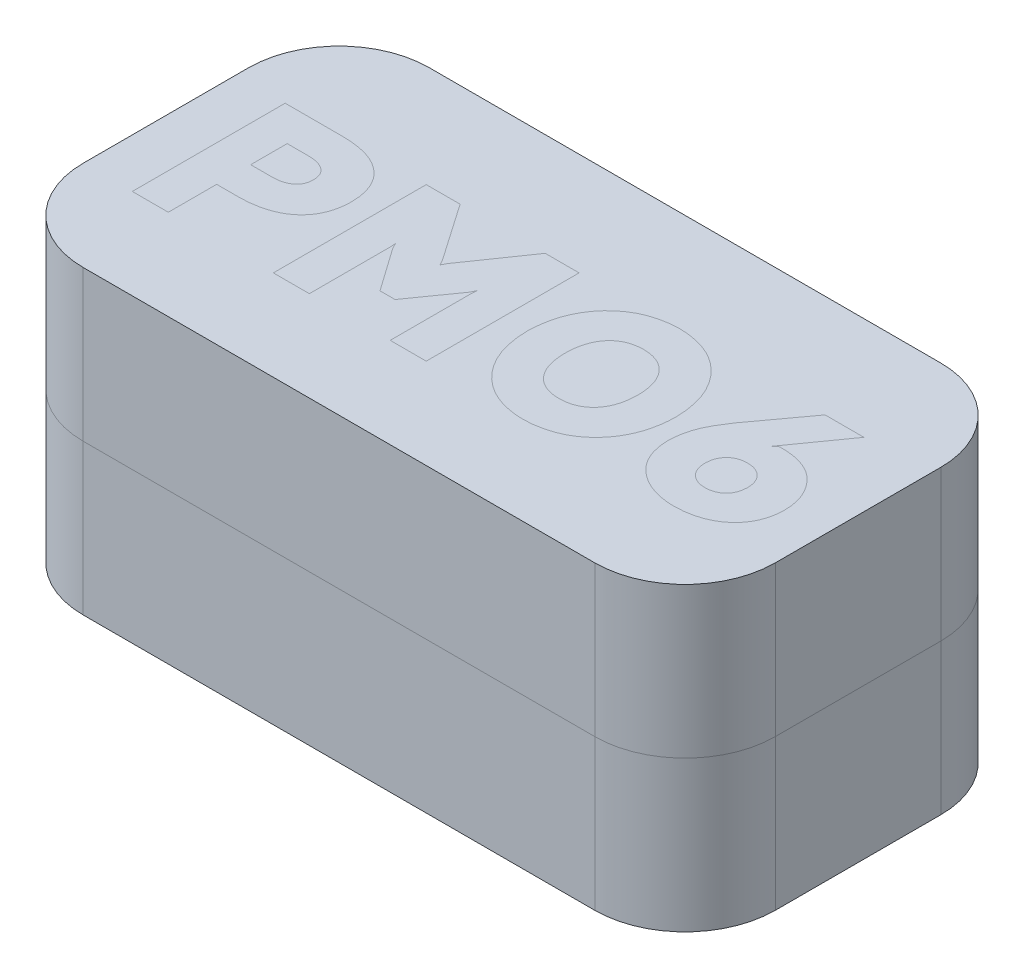
from build123d import *

# Parameters (mm, degrees)
SKETCH_1_W            = 23
SKETCH_1_H            = 11.5
EXTRUDE_1_DEPTH       = 5
EXTRUDE_2_DEPTH       = 5
SKETCH_3_W            = 23
SKETCH_3_H            = 11.5
EXTRUDE_3_DEPTH       = 5
CUT_EXTRUDE_1_DEPTH   = 5
CUT_EXTRUDE_1_2_DEPTH = 5
CUT_EXTRUDE_1_3_DEPTH = 5
CUT_EXTRUDE_1_4_DEPTH = 5
FILLET_1_R            = 3
FILLET_2_R            = 3


with BuildPart() as part:
    # 草图1 → 凸台-拉伸1 (new body)
    with BuildSketch(Plane(origin=(0, 0, 0), x_dir=(1, 0, 0), z_dir=(0, 1, 0))):
        with Locations((-19.454653859, 9.810538365)):
            Rectangle(SKETCH_1_W, SKETCH_1_H)
    extrude(amount=EXTRUDE_1_DEPTH)

    # 凸台-拉伸2: read off the stored shape, not the designer's step
    # 凸台-拉伸2 outline → 凸台-拉伸2 (add)
    # profile 1 of 4: a face of its own
    with BuildSketch(Plane(origin=(0, 5, 0), x_dir=(1, 0, 0), z_dir=(0, 1, 0))):
        with BuildLine():
            Line((-28.129151388, 8.671575234), (-27.395890908, 8.671575234))
            add(Edge.make_bspline(
                [(-27.395890908, 8.671575234), (-27.319081025, 8.672787804), (-27.168959784, 8.675157714), (-26.950533129, 8.699219659), (-26.744598421, 8.734709964), (-26.552770562, 8.786558897), (-26.373315547, 8.849829921), (-26.207649628, 8.928591334), (-26.054573054, 9.020709144), (-25.916378421, 9.127900638), (-25.792263197, 9.247004873), (-25.684919901, 9.379039136), (-25.593085455, 9.521954722), (-25.518757233, 9.677146987), (-25.459860234, 9.843731285), (-25.417419318, 10.021825224), (-25.390639685, 10.211373366), (-25.387014843, 10.341454814), (-25.38515633, 10.408149567)],
                knots=[0, 0, 0, 0, 0.076549003, 0.149611363, 0.218830612, 0.284693582, 0.347485423, 0.408290132, 0.467258209, 0.52525388, 0.582295534, 0.63838526, 0.694513761, 0.751268638, 0.809547054, 0.870343813, 0.933523285, 1, 1, 1, 1], degree=3))
            add(Edge.make_bspline(
                [(-25.38515633, 10.408149567), (-25.387024148, 10.474842092), (-25.39066714, 10.604919194), (-25.417270158, 10.794161945), (-25.460046265, 10.971824571), (-25.518738569, 11.138110458), (-25.593090346, 11.293297096), (-25.684918573, 11.436214285), (-25.792263656, 11.568247654), (-25.916377926, 11.687353906), (-26.054574602, 11.79453806), (-26.207643766, 11.886683984), (-26.37333846, 11.965335787), (-26.552595893, 12.029008466), (-26.744787036, 12.079119084), (-26.950501992, 12.11516162), (-27.169310347, 12.138791188), (-27.319733419, 12.142020798), (-27.396861438, 12.14367675)],
                knots=[0, 0, 0, 0, 0.066482887, 0.129668224, 0.19013268, 0.248416506, 0.305176652, 0.361310364, 0.417405297, 0.474452246, 0.532453301, 0.591426852, 0.652237206, 0.715034876, 0.780814888, 0.850040562, 0.923109705, 1, 1, 1, 1], degree=3))
            Line((-27.396861438, 12.14367675), (-29.325923415, 12.144721857))
            Line((-29.325923415, 12.144721857), (-29.325923415, 7.064721857))
            Line((-29.325923415, 7.064721857), (-28.129151388, 7.064721857))
            Line((-28.129151388, 7.064721857), (-28.129151388, 8.671575234))
        make_face()
        with BuildLine():
            add(Edge.make_bspline(
                [(-27.418110923, 11.014902055), (-27.361020554, 11.012586258), (-27.252354438, 11.008178358), (-27.098867586, 10.978202893), (-26.965007909, 10.92834159), (-26.851457602, 10.858778941), (-26.760898537, 10.770378579), (-26.695929163, 10.663604917), (-26.656355808, 10.540914397), (-26.65142965, 10.453434619), (-26.648879559, 10.408149567)],
                knots=[0, 0, 0, 0, 0.154983794, 0.294996987, 0.422664744, 0.54089679, 0.654049145, 0.762851187, 0.877236815, 1, 1, 1, 1], degree=3))
            add(Edge.make_bspline(
                [(-26.648879559, 10.408149567), (-26.651331142, 10.362485614), (-26.656031756, 10.274930511), (-26.696472707, 10.152263487), (-26.760505308, 10.044984353), (-26.851508406, 9.956505721), (-26.964992054, 9.886889256), (-27.098875825, 9.837110948), (-27.252551124, 9.806780317), (-27.361492236, 9.80325204), (-27.418830136, 9.801395037)],
                knots=[0, 0, 0, 0, 0.123527562, 0.236849148, 0.34630234, 0.459292114, 0.577354279, 0.704838598, 0.844650615, 1, 1, 1, 1], degree=3))
            Line((-27.418830136, 9.801395037), (-28.129151388, 9.801395037))
            Line((-28.129151388, 9.801395037), (-28.129151388, 11.014902055))
            Line((-28.129151388, 11.014902055), (-27.418110923, 11.014902055))
        make_face(mode=Mode.SUBTRACT)
    # profile 2 of 4: a face of its own
    with BuildSketch(Plane(origin=(0, 5, 0), x_dir=(1, 0, 0), z_dir=(0, 1, 0))):
        with BuildLine():
            Line((-16.278607731, 12.210628974), (-16.278043802, 12.211674081))
            add(Edge.make_bspline(
                [(-16.278043802, 12.211674081), (-16.367996121, 12.207787025), (-16.5439803, 12.200182326), (-16.800440794, 12.160408566), (-17.043498255, 12.100890551), (-17.274070672, 12.020788994), (-17.490661114, 11.916452983), (-17.693493851, 11.790213414), (-17.883095099, 11.642536529), (-18.058231893, 11.47479897), (-18.21569453, 11.288550498), (-18.354808101, 11.088169478), (-18.471867321, 10.87348403), (-18.57021386, 10.646171435), (-18.646194772, 10.404865633), (-18.701323048, 10.1499054), (-18.737441813, 9.881878686), (-18.744778123, 9.698290028), (-18.748517121, 9.604722879)],
                knots=[0, 0, 0, 0, 0.067185596, 0.131442993, 0.193393267, 0.253836926, 0.313346353, 0.372519901, 0.431894177, 0.492480673, 0.553257095, 0.613709166, 0.674304053, 0.73553611, 0.798366004, 0.862869808, 0.930110709, 1, 1, 1, 1], degree=3))
            add(Edge.make_bspline(
                [(-18.748517121, 9.604722879), (-18.744823882, 9.510800339), (-18.737604113, 9.327194812), (-18.701026136, 9.058904922), (-18.646611961, 8.804111483), (-18.569715735, 8.562762454), (-18.472179959, 8.335133326), (-18.354765633, 8.120247694), (-18.215706866, 7.91984241), (-18.058225217, 7.733609951), (-17.883109286, 7.565833033), (-17.693444845, 7.418294702), (-17.49097095, 7.291622296), (-17.273554182, 7.189210058), (-17.043776374, 7.107087222), (-16.800390813, 7.048178831), (-16.544215117, 7.007953445), (-16.368381248, 7.00121237), (-16.278607731, 6.997770655)],
                knots=[0, 0, 0, 0, 0.070144619, 0.137122991, 0.201876882, 0.264454512, 0.325921738, 0.386512618, 0.44696069, 0.507733092, 0.568315581, 0.627685929, 0.686855564, 0.746248743, 0.806775261, 0.868721437, 0.932974584, 1, 1, 1, 1], degree=3))
            add(Edge.make_bspline(
                [(-16.278607731, 6.997770655), (-16.188836837, 7.001233666), (-16.012663321, 7.008029755), (-15.756114486, 7.048067765), (-15.512370436, 7.107049998), (-15.282405012, 7.189488537), (-15.064312868, 7.291264617), (-14.861619857, 7.418678641), (-14.670982211, 7.565412708), (-14.495877222, 7.733960116), (-14.337388311, 7.919805176), (-14.197030821, 8.119911912), (-14.08013438, 8.335431576), (-13.980838459, 8.562461429), (-13.90473384, 8.80430152), (-13.848541473, 9.058739624), (-13.812132321, 9.3271871), (-13.805707722, 9.510803793), (-13.802421569, 9.604722879)],
                knots=[0, 0, 0, 0, 0.066947723, 0.131383517, 0.193257888, 0.253714246, 0.313273518, 0.372374566, 0.431881584, 0.492393847, 0.553264357, 0.613790589, 0.674311234, 0.735810115, 0.798315208, 0.863049954, 0.929950687, 1, 1, 1, 1], degree=3))
            add(Edge.make_bspline(
                [(-13.802421569, 9.604722879), (-13.80575374, 9.698286551), (-13.812292458, 9.881886509), (-13.84824182, 10.150072056), (-13.905153595, 10.404674178), (-13.980337867, 10.646474799), (-14.080447188, 10.87318453), (-14.196987918, 11.088505616), (-14.337400778, 11.288587632), (-14.495870534, 11.474448808), (-14.670996331, 11.64295697), (-14.861571003, 11.789829298), (-15.064621037, 11.916812208), (-15.281889737, 12.020507355), (-15.512647108, 12.100945387), (-15.756068466, 12.160453395), (-16.012675553, 12.200337572), (-16.188840966, 12.207155059), (-16.278607731, 12.210628974)],
                knots=[0, 0, 0, 0, 0.069805072, 0.136978467, 0.201473661, 0.264240475, 0.325514388, 0.386048441, 0.446588082, 0.507472077, 0.567997747, 0.627517948, 0.686632089, 0.746316321, 0.806699297, 0.868587376, 0.933037445, 1, 1, 1, 1], degree=3))
        make_face()
        with BuildLine():
            add(Edge.make_bspline(
                [(-16.278607731, 8.19454166), (-16.32468618, 8.196239355), (-16.41473942, 8.19955724), (-16.545991785, 8.21691388), (-16.669335263, 8.247548376), (-16.784630822, 8.289436395), (-16.892353167, 8.341756729), (-16.991878748, 8.406279462), (-17.082768524, 8.48297142), (-17.165768937, 8.570407265), (-17.240427031, 8.667544764), (-17.303572251, 8.775426105), (-17.360341716, 8.890445565), (-17.403089086, 9.016402275), (-17.439447212, 9.150367088), (-17.463593179, 9.29404645), (-17.47976828, 9.446395752), (-17.482396893, 9.55097734), (-17.483747764, 9.604722879)],
                knots=[0, 0, 0, 0, 0.065918113, 0.128826813, 0.188937796, 0.24730667, 0.303954491, 0.359835466, 0.416470115, 0.473611846, 0.531959414, 0.591226729, 0.652116633, 0.71504707, 0.781091444, 0.850450855, 0.923145178, 1, 1, 1, 1], degree=3))
            add(Edge.make_bspline(
                [(-17.483747764, 9.604722879), (-17.482396895, 9.65846842), (-17.479768287, 9.763050013), (-17.463593153, 9.915399279), (-17.4394473, 10.05907877), (-17.403088777, 10.193043134), (-17.360342796, 10.31900141), (-17.303568405, 10.434015315), (-17.240440884, 10.541916618), (-17.165718525, 10.638981633), (-17.083105272, 10.72651835), (-16.991559582, 10.802131202), (-16.892089142, 10.866393268), (-16.785142996, 10.920532367), (-16.66905644, 10.960449824), (-16.546038413, 10.991607809), (-16.414726879, 11.00880956), (-16.324681935, 11.012149162), (-16.278607731, 11.013857969)],
                knots=[0, 0, 0, 0, 0.076875311, 0.149589013, 0.218966915, 0.285028895, 0.347976109, 0.408882245, 0.468165361, 0.526528483, 0.583685447, 0.640015865, 0.695911737, 0.752795979, 0.811011835, 0.871138844, 0.934064314, 1, 1, 1, 1], degree=3))
            Line((-16.278607731, 11.013857969), (-16.278043802, 11.014902055))
            add(Edge.make_bspline(
                [(-16.278043802, 11.014902055), (-16.232861056, 11.012731778), (-16.144079778, 11.008467321), (-16.014302089, 10.991673461), (-15.892320847, 10.960457052), (-15.777013418, 10.92034316), (-15.670189348, 10.866124065), (-15.56979563, 10.80223423), (-15.477312598, 10.726183888), (-15.392437335, 10.639449803), (-15.317045503, 10.541585202), (-15.251240779, 10.434442761), (-15.194184861, 10.31875623), (-15.148232475, 10.193522923), (-15.112974888, 10.05889763), (-15.087254542, 9.915475307), (-15.069870022, 9.763103042), (-15.067409062, 9.658473837), (-15.066144798, 9.604722879)],
                knots=[0, 0, 0, 0, 0.064678254, 0.127088734, 0.186711865, 0.244438619, 0.301303941, 0.357600167, 0.414296895, 0.472126931, 0.530774567, 0.590555961, 0.651659935, 0.714925122, 0.78096513, 0.850407738, 0.923150257, 1, 1, 1, 1], degree=3))
            add(Edge.make_bspline(
                [(-15.066144798, 9.604722879), (-15.067409065, 9.550971923), (-15.069870028, 9.446342723), (-15.087254517, 9.293970422), (-15.112974976, 9.150548228), (-15.148232171, 9.015922487), (-15.19418593, 8.890690748), (-15.25123697, 8.774998648), (-15.317059281, 8.667876288), (-15.392387254, 8.569938768), (-15.477651033, 8.483312071), (-15.56947784, 8.406173853), (-15.669922162, 8.342019905), (-15.777527134, 8.289628418), (-15.892039878, 8.247526485), (-16.014352759, 8.216915991), (-16.144218133, 8.199605739), (-16.233226932, 8.196251703), (-16.278607731, 8.19454166)],
                knots=[0, 0, 0, 0, 0.076810927, 0.149516705, 0.218924238, 0.28493089, 0.348164123, 0.409237233, 0.468988433, 0.527606447, 0.585407274, 0.642392272, 0.698660064, 0.75527553, 0.81314293, 0.872735947, 0.935114904, 1, 1, 1, 1], degree=3))
        make_face(mode=Mode.SUBTRACT)
    # profile 3 of 4: a face of its own
    with BuildSketch(Plane(origin=(0, 5, 0), x_dir=(1, 0, 0), z_dir=(0, 1, 0))):
        with BuildLine():
            Line((-11.385509212, 12.144721857), (-12.347576589, 10.830639392))
            add(Edge.make_bspline(
                [(-12.347576589, 10.830639392), (-12.413090891, 10.745467769), (-12.540655325, 10.57962811), (-12.71450652, 10.327814258), (-12.868993769, 10.081687587), (-12.98311645, 9.87762154), (-13.063001351, 9.714625507), (-13.11344012, 9.590119856), (-13.156011816, 9.462845948), (-13.191982725, 9.332303511), (-13.220074859, 9.198465037), (-13.240817105, 9.061206324), (-13.255105772, 8.920846972), (-13.257318407, 8.826089436), (-13.258434749, 8.778281363)],
                knots=[0, 0, 0, 0, 0.140704677, 0.273969371, 0.400554941, 0.521159582, 0.579983893, 0.638159374, 0.696935803, 0.755653658, 0.815394392, 0.875912049, 0.937393836, 1, 1, 1, 1], degree=3))
            add(Edge.make_bspline(
                [(-13.258434749, 8.778281363), (-13.255008661, 8.710128081), (-13.248329889, 8.577270914), (-13.214121036, 8.38460512), (-13.167840253, 8.202486689), (-13.099379986, 8.033423766), (-13.017009498, 7.874757783), (-12.915555695, 7.728739501), (-12.79766124, 7.594000551), (-12.663857931, 7.472122091), (-12.517219366, 7.364168704), (-12.362492547, 7.267993843), (-12.198211053, 7.188901198), (-12.027154029, 7.122763903), (-11.848160179, 7.069817285), (-11.660807376, 7.032812239), (-11.465622602, 7.009097501), (-11.332929829, 7.005748008), (-11.265559955, 7.004047426)],
                knots=[0, 0, 0, 0, 0.068549071, 0.133628715, 0.196395616, 0.257143926, 0.316587031, 0.375818801, 0.435454973, 0.496259922, 0.557410646, 0.618328717, 0.679173081, 0.740446321, 0.802578327, 0.866598053, 0.932270068, 1, 1, 1, 1], degree=3))
            add(Edge.make_bspline(
                [(-11.265559955, 7.004047426), (-11.195755966, 7.006173454), (-11.059262616, 7.010330648), (-10.859472286, 7.033534076), (-10.669868292, 7.071039227), (-10.4899791, 7.12243585), (-10.31955218, 7.187234657), (-10.158869881, 7.266773778), (-10.008807652, 7.36147261), (-9.869532376, 7.469163008), (-9.743018735, 7.588786851), (-9.632178935, 7.720254833), (-9.538932682, 7.8630503), (-9.459344772, 8.014844205), (-9.398970413, 8.178953692), (-9.354083551, 8.352737476), (-9.325442215, 8.537476115), (-9.319612254, 8.664151942), (-9.316622558, 8.729113324)],
                knots=[0, 0, 0, 0, 0.071733061, 0.14026542, 0.206388532, 0.270124128, 0.332274931, 0.393485996, 0.454026432, 0.514300146, 0.57411202, 0.632604319, 0.690540881, 0.74903318, 0.808330925, 0.869772265, 0.933217143, 1, 1, 1, 1], degree=3))
            add(Edge.make_bspline(
                [(-9.316622558, 8.729113324), (-9.318224458, 8.788830322), (-9.321376023, 8.906317062), (-9.346483888, 9.078903148), (-9.385060052, 9.244882537), (-9.438167073, 9.40465136), (-9.507849899, 9.556823833), (-9.591990555, 9.702432746), (-9.692264231, 9.840539613), (-9.805382645, 9.97243588), (-9.933407299, 10.092612248), (-10.075832607, 10.197246118), (-10.232163856, 10.284227318), (-10.401480861, 10.355740362), (-10.58468501, 10.409959364), (-10.781274553, 10.447214568), (-10.991006409, 10.468146889), (-11.135095271, 10.469286225), (-11.209069016, 10.469871149)],
                knots=[0, 0, 0, 0, 0.06173791, 0.121462665, 0.179986292, 0.23780786, 0.295263865, 0.352791133, 0.41144352, 0.471528694, 0.532256589, 0.592632212, 0.653828421, 0.716858975, 0.782353709, 0.851032858, 0.923521797, 1, 1, 1, 1], degree=3))
            add(Edge.make_bspline(
                [(-11.209069016, 10.469871149), (-11.221590774, 10.465578586), (-11.252649025, 10.454931558), (-11.293532909, 10.420022971), (-11.335067912, 10.384671063), (-11.361148922, 10.360790692), (-11.372265062, 10.3506125)],
                knots=[0, 0, 0, 0, 0.193489443, 0.479920127, 0.778333709, 1, 1, 1, 1], degree=3))
            Line((-11.372265062, 10.3506125), (-10.095511199, 12.144721857))
            Line((-10.095511199, 12.144721857), (-11.385509212, 12.144721857))
        make_face()
        with BuildLine():
            add(Edge.make_bspline(
                [(-11.287528653, 9.473956816), (-11.23671693, 9.47129141), (-11.139253115, 9.466178798), (-11.000848953, 9.428582486), (-10.878332292, 9.367527995), (-10.773797661, 9.282339001), (-10.687702646, 9.178386738), (-10.626666711, 9.054769638), (-10.587840991, 8.915183749), (-10.582912109, 8.816212882), (-10.580345787, 8.764681693)],
                knots=[0, 0, 0, 0, 0.135365633, 0.259649747, 0.379409822, 0.497761076, 0.616698944, 0.736459019, 0.862782042, 1, 1, 1, 1], degree=3))
            add(Edge.make_bspline(
                [(-10.580345787, 8.764681693), (-10.582894527, 8.713141164), (-10.587789642, 8.614152361), (-10.626933901, 8.474388361), (-10.687357563, 8.350079093), (-10.773880768, 8.246101883), (-10.878021294, 8.160486636), (-11.001334154, 8.101343643), (-11.138850381, 8.061744896), (-11.236323117, 8.056890074), (-11.2870117, 8.054385978)],
                knots=[0, 0, 0, 0, 0.137127204, 0.263366679, 0.383877937, 0.502737142, 0.621010121, 0.740275435, 0.864723895, 0.999541682, 0.999541682, 0.999541682, 0.999541682], degree=3))
            add(Edge.make_bspline(
                [(-11.2870117, 8.054385978), (-11.337676741, 8.05694986), (-11.435444962, 8.061934965), (-11.573222988, 8.100860364), (-11.696164274, 8.160836651), (-11.800148891, 8.246061466), (-11.886648587, 8.35009009), (-11.947078694, 8.474385263), (-11.986221139, 8.61415323), (-11.991116515, 8.713141462), (-11.993665391, 8.764681693)],
                knots=[0.000447569, 0.000447569, 0.000447569, 0.000447569, 0.135248769, 0.260587261, 0.379015796, 0.497283839, 0.616138083, 0.736644312, 0.862878519, 1, 1, 1, 1], degree=3))
            add(Edge.make_bspline(
                [(-11.993665391, 8.764681693), (-11.99109893, 8.816212582), (-11.98616978, 8.915182874), (-11.947345916, 9.05477275), (-11.886303417, 9.178375746), (-11.800232466, 9.28237972), (-11.695851232, 9.367178585), (-11.573709726, 9.429065843), (-11.435377835, 9.465895437), (-11.337969539, 9.47120656), (-11.287528653, 9.473956816)],
                knots=[0, 0, 0, 0, 0.137335784, 0.263767278, 0.383630188, 0.502670186, 0.621123066, 0.740155788, 0.865445012, 1, 1, 1, 1], degree=3))
        make_face(mode=Mode.SUBTRACT)
    # profile 4 of 4: a face of its own
    with BuildSketch(Plane(origin=(0, 5, 0), x_dir=(1, 0, 0), z_dir=(0, 1, 0))):
        Polygon((-24.639267731, 7.064721857), (-23.442495704, 7.064721857), (-23.442495704, 9.764517986), (-23.456735924, 9.945955898), (-23.368694608, 9.764517986), (-22.350239475, 8.320272207), (-21.848392018, 8.320272207), (-20.829936885, 9.764517986), (-20.741792386, 9.945955898), (-20.756039758, 9.764517986), (-20.756039758, 7.064721857), (-19.559267731, 7.064721857), (-19.559267731, 12.144721857), (-20.684802902, 12.144721857), (-22.010754431, 10.22899904), (-22.099315747, 10.062076161), (-22.187877063, 10.22899904), (-23.513725409, 12.144721857), (-24.639267731, 12.144721857), align=None)
    extrude(amount=EXTRUDE_2_DEPTH)

    # 圆角2
    fillet_2_edges = [part.edges().sort_by_distance(p)[0] for p in [
        (-30.954653859, 2.5, -15.560538365),
        (-7.954653859, 2.5, -15.560538365),
        (-7.954653859, 2.5, -4.060538365),
        (-30.954653859, 2.5, -4.060538365),
    ]]
    fillet(fillet_2_edges, radius=FILLET_2_R)


with BuildPart() as body_2:
    # 草图3 → 凸台-拉伸3 (new body)
    with BuildSketch(Plane(origin=(0, 10, 0), x_dir=(1, 0, 0), z_dir=(0, 1, 0))):
        with Locations((-19.454653859, 9.810538365)):
            Rectangle(SKETCH_3_W, SKETCH_3_H)
    extrude(amount=-EXTRUDE_3_DEPTH)

    # 切除-拉伸1: read off the stored shape, not the designer's step
    # 切除-拉伸1 outline → 切除-拉伸1 (cut)
    with BuildSketch(Plane(origin=(0, 5, 0), x_dir=(1, 0, 0), z_dir=(0, 1, 0))):
        with BuildLine():
            Line((-11.385509212, 12.144721857), (-12.347576589, 10.830639392))
            add(Edge.make_bspline(
                [(-12.347576589, 10.830639392), (-12.413090891, 10.745467769), (-12.540655325, 10.57962811), (-12.71450652, 10.327814258), (-12.868993769, 10.081687587), (-12.98311645, 9.87762154), (-13.063001351, 9.714625507), (-13.11344012, 9.590119856), (-13.156011816, 9.462845948), (-13.191982725, 9.332303511), (-13.220074859, 9.198465037), (-13.240817105, 9.061206324), (-13.255105772, 8.920846972), (-13.257318407, 8.826089436), (-13.258434749, 8.778281363)],
                knots=[0, 0, 0, 0, 0.140704677, 0.273969371, 0.400554941, 0.521159582, 0.579983893, 0.638159374, 0.696935803, 0.755653658, 0.815394392, 0.875912049, 0.937393836, 1, 1, 1, 1], degree=3))
            add(Edge.make_bspline(
                [(-13.258434749, 8.778281363), (-13.255008661, 8.710128081), (-13.248329889, 8.577270914), (-13.214121036, 8.38460512), (-13.167840253, 8.202486689), (-13.099379986, 8.033423766), (-13.017009498, 7.874757783), (-12.915555695, 7.728739501), (-12.79766124, 7.594000551), (-12.663857931, 7.472122091), (-12.517219366, 7.364168704), (-12.362492547, 7.267993843), (-12.198211053, 7.188901198), (-12.027154029, 7.122763903), (-11.848160179, 7.069817285), (-11.660807376, 7.032812239), (-11.465622602, 7.009097501), (-11.332929829, 7.005748008), (-11.265559955, 7.004047426)],
                knots=[0, 0, 0, 0, 0.068549071, 0.133628715, 0.196395616, 0.257143926, 0.316587031, 0.375818801, 0.435454973, 0.496259922, 0.557410646, 0.618328717, 0.679173081, 0.740446321, 0.802578327, 0.866598053, 0.932270068, 1, 1, 1, 1], degree=3))
            add(Edge.make_bspline(
                [(-11.265559955, 7.004047426), (-11.195755966, 7.006173454), (-11.059262616, 7.010330648), (-10.859472286, 7.033534076), (-10.669868292, 7.071039227), (-10.4899791, 7.12243585), (-10.31955218, 7.187234657), (-10.158869881, 7.266773778), (-10.008807652, 7.36147261), (-9.869532376, 7.469163008), (-9.743018735, 7.588786851), (-9.632178935, 7.720254833), (-9.538932682, 7.8630503), (-9.459344772, 8.014844205), (-9.398970413, 8.178953692), (-9.354083551, 8.352737476), (-9.325442215, 8.537476115), (-9.319612254, 8.664151942), (-9.316622558, 8.729113324)],
                knots=[0, 0, 0, 0, 0.071733061, 0.14026542, 0.206388532, 0.270124128, 0.332274931, 0.393485996, 0.454026432, 0.514300146, 0.57411202, 0.632604319, 0.690540881, 0.74903318, 0.808330925, 0.869772265, 0.933217143, 1, 1, 1, 1], degree=3))
            add(Edge.make_bspline(
                [(-9.316622558, 8.729113324), (-9.318224458, 8.788830322), (-9.321376023, 8.906317062), (-9.346483888, 9.078903148), (-9.385060052, 9.244882537), (-9.438167073, 9.40465136), (-9.507849899, 9.556823833), (-9.591990555, 9.702432746), (-9.692264231, 9.840539613), (-9.805382645, 9.97243588), (-9.933407299, 10.092612248), (-10.075832607, 10.197246118), (-10.232163856, 10.284227318), (-10.401480861, 10.355740362), (-10.58468501, 10.409959364), (-10.781274553, 10.447214568), (-10.991006409, 10.468146889), (-11.135095271, 10.469286225), (-11.209069016, 10.469871149)],
                knots=[0, 0, 0, 0, 0.06173791, 0.121462665, 0.179986292, 0.23780786, 0.295263865, 0.352791133, 0.41144352, 0.471528694, 0.532256589, 0.592632212, 0.653828421, 0.716858975, 0.782353709, 0.851032858, 0.923521797, 1, 1, 1, 1], degree=3))
            add(Edge.make_bspline(
                [(-11.209069016, 10.469871149), (-11.221590774, 10.465578586), (-11.252649025, 10.454931558), (-11.293532909, 10.420022971), (-11.335067912, 10.384671063), (-11.361148922, 10.360790692), (-11.372265062, 10.3506125)],
                knots=[0, 0, 0, 0, 0.193489443, 0.479920127, 0.778333709, 1, 1, 1, 1], degree=3))
            Line((-11.372265062, 10.3506125), (-10.095511199, 12.144721857))
            Line((-10.095511199, 12.144721857), (-11.385509212, 12.144721857))
        make_face()
        with BuildLine():
            Line((-16.278607731, 12.210628974), (-16.278043802, 12.211674081))
            add(Edge.make_bspline(
                [(-16.278043802, 12.211674081), (-16.367996121, 12.207787025), (-16.5439803, 12.200182326), (-16.800440794, 12.160408566), (-17.043498255, 12.100890551), (-17.274070672, 12.020788994), (-17.490661114, 11.916452983), (-17.693493851, 11.790213414), (-17.883095099, 11.642536529), (-18.058231893, 11.47479897), (-18.21569453, 11.288550498), (-18.354808101, 11.088169478), (-18.471867321, 10.87348403), (-18.57021386, 10.646171435), (-18.646194772, 10.404865633), (-18.701323048, 10.1499054), (-18.737441813, 9.881878686), (-18.744778123, 9.698290028), (-18.748517121, 9.604722879)],
                knots=[0, 0, 0, 0, 0.067185596, 0.131442993, 0.193393267, 0.253836926, 0.313346353, 0.372519901, 0.431894177, 0.492480673, 0.553257095, 0.613709166, 0.674304053, 0.73553611, 0.798366004, 0.862869808, 0.930110709, 1, 1, 1, 1], degree=3))
            add(Edge.make_bspline(
                [(-18.748517121, 9.604722879), (-18.744823882, 9.510800339), (-18.737604113, 9.327194812), (-18.701026136, 9.058904922), (-18.646611961, 8.804111483), (-18.569715735, 8.562762454), (-18.472179959, 8.335133326), (-18.354765633, 8.120247694), (-18.215706866, 7.91984241), (-18.058225217, 7.733609951), (-17.883109286, 7.565833033), (-17.693444845, 7.418294702), (-17.49097095, 7.291622296), (-17.273554182, 7.189210058), (-17.043776374, 7.107087222), (-16.800390813, 7.048178831), (-16.544215117, 7.007953445), (-16.368381248, 7.00121237), (-16.278607731, 6.997770655)],
                knots=[0, 0, 0, 0, 0.070144619, 0.137122991, 0.201876882, 0.264454512, 0.325921738, 0.386512618, 0.44696069, 0.507733092, 0.568315581, 0.627685929, 0.686855564, 0.746248743, 0.806775261, 0.868721437, 0.932974584, 1, 1, 1, 1], degree=3))
            add(Edge.make_bspline(
                [(-16.278607731, 6.997770655), (-16.188836837, 7.001233666), (-16.012663321, 7.008029755), (-15.756114486, 7.048067765), (-15.512370436, 7.107049998), (-15.282405012, 7.189488537), (-15.064312868, 7.291264617), (-14.861619857, 7.418678641), (-14.670982211, 7.565412708), (-14.495877222, 7.733960116), (-14.337388311, 7.919805176), (-14.197030821, 8.119911912), (-14.08013438, 8.335431576), (-13.980838459, 8.562461429), (-13.90473384, 8.80430152), (-13.848541473, 9.058739624), (-13.812132321, 9.3271871), (-13.805707722, 9.510803793), (-13.802421569, 9.604722879)],
                knots=[0, 0, 0, 0, 0.066947723, 0.131383517, 0.193257888, 0.253714246, 0.313273518, 0.372374566, 0.431881584, 0.492393847, 0.553264357, 0.613790589, 0.674311234, 0.735810115, 0.798315208, 0.863049954, 0.929950687, 1, 1, 1, 1], degree=3))
            add(Edge.make_bspline(
                [(-13.802421569, 9.604722879), (-13.80575374, 9.698286551), (-13.812292458, 9.881886509), (-13.84824182, 10.150072056), (-13.905153595, 10.404674178), (-13.980337867, 10.646474799), (-14.080447188, 10.87318453), (-14.196987918, 11.088505616), (-14.337400778, 11.288587632), (-14.495870534, 11.474448808), (-14.670996331, 11.64295697), (-14.861571003, 11.789829298), (-15.064621037, 11.916812208), (-15.281889737, 12.020507355), (-15.512647108, 12.100945387), (-15.756068466, 12.160453395), (-16.012675553, 12.200337572), (-16.188840966, 12.207155059), (-16.278607731, 12.210628974)],
                knots=[0, 0, 0, 0, 0.069805072, 0.136978467, 0.201473661, 0.264240475, 0.325514388, 0.386048441, 0.446588082, 0.507472077, 0.567997747, 0.627517948, 0.686632089, 0.746316321, 0.806699297, 0.868587376, 0.933037445, 1, 1, 1, 1], degree=3))
        make_face()
        with BuildLine():
            Line((-28.129151388, 8.671575234), (-27.395890908, 8.671575234))
            add(Edge.make_bspline(
                [(-27.395890908, 8.671575234), (-27.319081025, 8.672787804), (-27.168959784, 8.675157714), (-26.950533129, 8.699219659), (-26.744598421, 8.734709964), (-26.552770562, 8.786558897), (-26.373315547, 8.849829921), (-26.207649628, 8.928591334), (-26.054573054, 9.020709144), (-25.916378421, 9.127900638), (-25.792263197, 9.247004873), (-25.684919901, 9.379039136), (-25.593085455, 9.521954722), (-25.518757233, 9.677146987), (-25.459860234, 9.843731285), (-25.417419318, 10.021825224), (-25.390639685, 10.211373366), (-25.387014843, 10.341454814), (-25.38515633, 10.408149567)],
                knots=[0, 0, 0, 0, 0.076549003, 0.149611363, 0.218830612, 0.284693582, 0.347485423, 0.408290132, 0.467258209, 0.52525388, 0.582295534, 0.63838526, 0.694513761, 0.751268638, 0.809547054, 0.870343813, 0.933523285, 1, 1, 1, 1], degree=3))
            add(Edge.make_bspline(
                [(-25.38515633, 10.408149567), (-25.387024148, 10.474842092), (-25.39066714, 10.604919194), (-25.417270158, 10.794161945), (-25.460046265, 10.971824571), (-25.518738569, 11.138110458), (-25.593090346, 11.293297096), (-25.684918573, 11.436214285), (-25.792263656, 11.568247654), (-25.916377926, 11.687353906), (-26.054574602, 11.79453806), (-26.207643766, 11.886683984), (-26.37333846, 11.965335787), (-26.552595893, 12.029008466), (-26.744787036, 12.079119084), (-26.950501992, 12.11516162), (-27.169310347, 12.138791188), (-27.319733419, 12.142020798), (-27.396861438, 12.14367675)],
                knots=[0, 0, 0, 0, 0.066482887, 0.129668224, 0.19013268, 0.248416506, 0.305176652, 0.361310364, 0.417405297, 0.474452246, 0.532453301, 0.591426852, 0.652237206, 0.715034876, 0.780814888, 0.850040562, 0.923109705, 1, 1, 1, 1], degree=3))
            Line((-27.396861438, 12.14367675), (-29.325923415, 12.144721857))
            Line((-29.325923415, 12.144721857), (-29.325923415, 7.064721857))
            Line((-29.325923415, 7.064721857), (-28.129151388, 7.064721857))
            Line((-28.129151388, 7.064721857), (-28.129151388, 8.671575234))
        make_face()
        Polygon((-19.559267731, 12.144721857), (-20.684802902, 12.144721857), (-22.010754431, 10.22899904), (-22.099315747, 10.062076161), (-22.187877063, 10.22899904), (-23.513725409, 12.144721857), (-24.639267731, 12.144721857), (-24.639267731, 7.064721857), (-23.442495704, 7.064721857), (-23.442495704, 9.764517986), (-23.456735924, 9.945955898), (-23.368694608, 9.764517986), (-22.350239475, 8.320272207), (-21.848392018, 8.320272207), (-20.829936885, 9.764517986), (-20.741792386, 9.945955898), (-20.756039758, 9.764517986), (-20.756039758, 7.064721857), (-19.559267731, 7.064721857), align=None)
    extrude(amount=CUT_EXTRUDE_1_DEPTH, mode=Mode.SUBTRACT)

    # 圆角1
    fillet_1_edges = [body_2.edges().sort_by_distance(p)[0] for p in [
        (-30.954653859, 7.5, -4.060538365),
        (-30.954653859, 7.5, -15.560538365),
        (-7.954653859, 7.5, -15.560538365),
        (-7.954653859, 7.5, -4.060538365),
    ]]
    fillet(fillet_1_edges, radius=FILLET_1_R)


with BuildPart() as body_3:
    # Cut-Extrude 1 2 outline → Cut-Extrude 1 2 (new body)
    with BuildSketch(Plane(origin=(0, 5, 0), x_dir=(1, 0, 0), z_dir=(0, 1, 0))):
        with BuildLine():
            add(Edge.make_bspline(
                [(-11.2870117, 8.054385978), (-11.337676741, 8.05694986), (-11.435444962, 8.061934965), (-11.573222988, 8.100860364), (-11.696164274, 8.160836651), (-11.800148891, 8.246061466), (-11.886648587, 8.35009009), (-11.947078694, 8.474385263), (-11.986221139, 8.61415323), (-11.991116515, 8.713141462), (-11.993665391, 8.764681693)],
                knots=[0.000447569, 0.000447569, 0.000447569, 0.000447569, 0.135248769, 0.260587261, 0.379015796, 0.497283839, 0.616138083, 0.736644312, 0.862878519, 1, 1, 1, 1], degree=3))
            add(Edge.make_bspline(
                [(-10.580345787, 8.764681693), (-10.582894527, 8.713141164), (-10.587789642, 8.614152361), (-10.626933901, 8.474388361), (-10.687357563, 8.350079093), (-10.773880768, 8.246101883), (-10.878021294, 8.160486636), (-11.001334154, 8.101343643), (-11.138850381, 8.061744896), (-11.236323117, 8.056890074), (-11.2870117, 8.054385978)],
                knots=[0, 0, 0, 0, 0.137127204, 0.263366679, 0.383877937, 0.502737142, 0.621010121, 0.740275435, 0.864723895, 0.999541682, 0.999541682, 0.999541682, 0.999541682], degree=3))
            add(Edge.make_bspline(
                [(-11.287528653, 9.473956816), (-11.23671693, 9.47129141), (-11.139253115, 9.466178798), (-11.000848953, 9.428582486), (-10.878332292, 9.367527995), (-10.773797661, 9.282339001), (-10.687702646, 9.178386738), (-10.626666711, 9.054769638), (-10.587840991, 8.915183749), (-10.582912109, 8.816212882), (-10.580345787, 8.764681693)],
                knots=[0, 0, 0, 0, 0.135365633, 0.259649747, 0.379409822, 0.497761076, 0.616698944, 0.736459019, 0.862782042, 1, 1, 1, 1], degree=3))
            add(Edge.make_bspline(
                [(-11.993665391, 8.764681693), (-11.99109893, 8.816212582), (-11.98616978, 8.915182874), (-11.947345916, 9.05477275), (-11.886303417, 9.178375746), (-11.800232466, 9.28237972), (-11.695851232, 9.367178585), (-11.573709726, 9.429065843), (-11.435377835, 9.465895437), (-11.337969539, 9.47120656), (-11.287528653, 9.473956816)],
                knots=[0, 0, 0, 0, 0.137335784, 0.263767278, 0.383630188, 0.502670186, 0.621123066, 0.740155788, 0.865445012, 1, 1, 1, 1], degree=3))
        make_face()
    extrude(amount=CUT_EXTRUDE_1_2_DEPTH)


with BuildPart() as body_4:
    # Cut-Extrude 1 3 outline → Cut-Extrude 1 3 (new body)
    with BuildSketch(Plane(origin=(0, 5, 0), x_dir=(1, 0, 0), z_dir=(0, 1, 0))):
        with BuildLine():
            add(Edge.make_bspline(
                [(-16.278043802, 11.014902055), (-16.232861056, 11.012731778), (-16.144079778, 11.008467321), (-16.014302089, 10.991673461), (-15.892320847, 10.960457052), (-15.777013418, 10.92034316), (-15.670189348, 10.866124065), (-15.56979563, 10.80223423), (-15.477312598, 10.726183888), (-15.392437335, 10.639449803), (-15.317045503, 10.541585202), (-15.251240779, 10.434442761), (-15.194184861, 10.31875623), (-15.148232475, 10.193522923), (-15.112974888, 10.05889763), (-15.087254542, 9.915475307), (-15.069870022, 9.763103042), (-15.067409062, 9.658473837), (-15.066144798, 9.604722879)],
                knots=[0, 0, 0, 0, 0.064678254, 0.127088734, 0.186711865, 0.244438619, 0.301303941, 0.357600167, 0.414296895, 0.472126931, 0.530774567, 0.590555961, 0.651659935, 0.714925122, 0.78096513, 0.850407738, 0.923150257, 1, 1, 1, 1], degree=3))
            Line((-16.278043802, 11.014902055), (-16.278607731, 11.013857969))
            add(Edge.make_bspline(
                [(-17.483747764, 9.604722879), (-17.482396895, 9.65846842), (-17.479768287, 9.763050013), (-17.463593153, 9.915399279), (-17.4394473, 10.05907877), (-17.403088777, 10.193043134), (-17.360342796, 10.31900141), (-17.303568405, 10.434015315), (-17.240440884, 10.541916618), (-17.165718525, 10.638981633), (-17.083105272, 10.72651835), (-16.991559582, 10.802131202), (-16.892089142, 10.866393268), (-16.785142996, 10.920532367), (-16.66905644, 10.960449824), (-16.546038413, 10.991607809), (-16.414726879, 11.00880956), (-16.324681935, 11.012149162), (-16.278607731, 11.013857969)],
                knots=[0, 0, 0, 0, 0.076875311, 0.149589013, 0.218966915, 0.285028895, 0.347976109, 0.408882245, 0.468165361, 0.526528483, 0.583685447, 0.640015865, 0.695911737, 0.752795979, 0.811011835, 0.871138844, 0.934064314, 1, 1, 1, 1], degree=3))
            add(Edge.make_bspline(
                [(-16.278607731, 8.19454166), (-16.32468618, 8.196239355), (-16.41473942, 8.19955724), (-16.545991785, 8.21691388), (-16.669335263, 8.247548376), (-16.784630822, 8.289436395), (-16.892353167, 8.341756729), (-16.991878748, 8.406279462), (-17.082768524, 8.48297142), (-17.165768937, 8.570407265), (-17.240427031, 8.667544764), (-17.303572251, 8.775426105), (-17.360341716, 8.890445565), (-17.403089086, 9.016402275), (-17.439447212, 9.150367088), (-17.463593179, 9.29404645), (-17.47976828, 9.446395752), (-17.482396893, 9.55097734), (-17.483747764, 9.604722879)],
                knots=[0, 0, 0, 0, 0.065918113, 0.128826813, 0.188937796, 0.24730667, 0.303954491, 0.359835466, 0.416470115, 0.473611846, 0.531959414, 0.591226729, 0.652116633, 0.71504707, 0.781091444, 0.850450855, 0.923145178, 1, 1, 1, 1], degree=3))
            add(Edge.make_bspline(
                [(-15.066144798, 9.604722879), (-15.067409065, 9.550971923), (-15.069870028, 9.446342723), (-15.087254517, 9.293970422), (-15.112974976, 9.150548228), (-15.148232171, 9.015922487), (-15.19418593, 8.890690748), (-15.25123697, 8.774998648), (-15.317059281, 8.667876288), (-15.392387254, 8.569938768), (-15.477651033, 8.483312071), (-15.56947784, 8.406173853), (-15.669922162, 8.342019905), (-15.777527134, 8.289628418), (-15.892039878, 8.247526485), (-16.014352759, 8.216915991), (-16.144218133, 8.199605739), (-16.233226932, 8.196251703), (-16.278607731, 8.19454166)],
                knots=[0, 0, 0, 0, 0.076810927, 0.149516705, 0.218924238, 0.28493089, 0.348164123, 0.409237233, 0.468988433, 0.527606447, 0.585407274, 0.642392272, 0.698660064, 0.75527553, 0.81314293, 0.872735947, 0.935114904, 1, 1, 1, 1], degree=3))
        make_face()
    extrude(amount=CUT_EXTRUDE_1_3_DEPTH)


with BuildPart() as body_5:
    # Cut-Extrude 1 4 outline → Cut-Extrude 1 4 (new body)
    with BuildSketch(Plane(origin=(0, 5, 0), x_dir=(1, 0, 0), z_dir=(0, 1, 0))):
        with BuildLine():
            Line((-27.418110923, 11.014902055), (-28.129151388, 11.014902055))
            Line((-28.129151388, 11.014902055), (-28.129151388, 9.801395037))
            Line((-28.129151388, 9.801395037), (-27.418830136, 9.801395037))
            add(Edge.make_bspline(
                [(-26.648879559, 10.408149567), (-26.651331142, 10.362485614), (-26.656031756, 10.274930511), (-26.696472707, 10.152263487), (-26.760505308, 10.044984353), (-26.851508406, 9.956505721), (-26.964992054, 9.886889256), (-27.098875825, 9.837110948), (-27.252551124, 9.806780317), (-27.361492236, 9.80325204), (-27.418830136, 9.801395037)],
                knots=[0, 0, 0, 0, 0.123527562, 0.236849148, 0.34630234, 0.459292114, 0.577354279, 0.704838598, 0.844650615, 1, 1, 1, 1], degree=3))
            add(Edge.make_bspline(
                [(-27.418110923, 11.014902055), (-27.361020554, 11.012586258), (-27.252354438, 11.008178358), (-27.098867586, 10.978202893), (-26.965007909, 10.92834159), (-26.851457602, 10.858778941), (-26.760898537, 10.770378579), (-26.695929163, 10.663604917), (-26.656355808, 10.540914397), (-26.65142965, 10.453434619), (-26.648879559, 10.408149567)],
                knots=[0, 0, 0, 0, 0.154983794, 0.294996987, 0.422664744, 0.54089679, 0.654049145, 0.762851187, 0.877236815, 1, 1, 1, 1], degree=3))
        make_face()
    extrude(amount=CUT_EXTRUDE_1_4_DEPTH)


solid = Compound([part.part, body_2.part, body_3.part, body_4.part, body_5.part])
